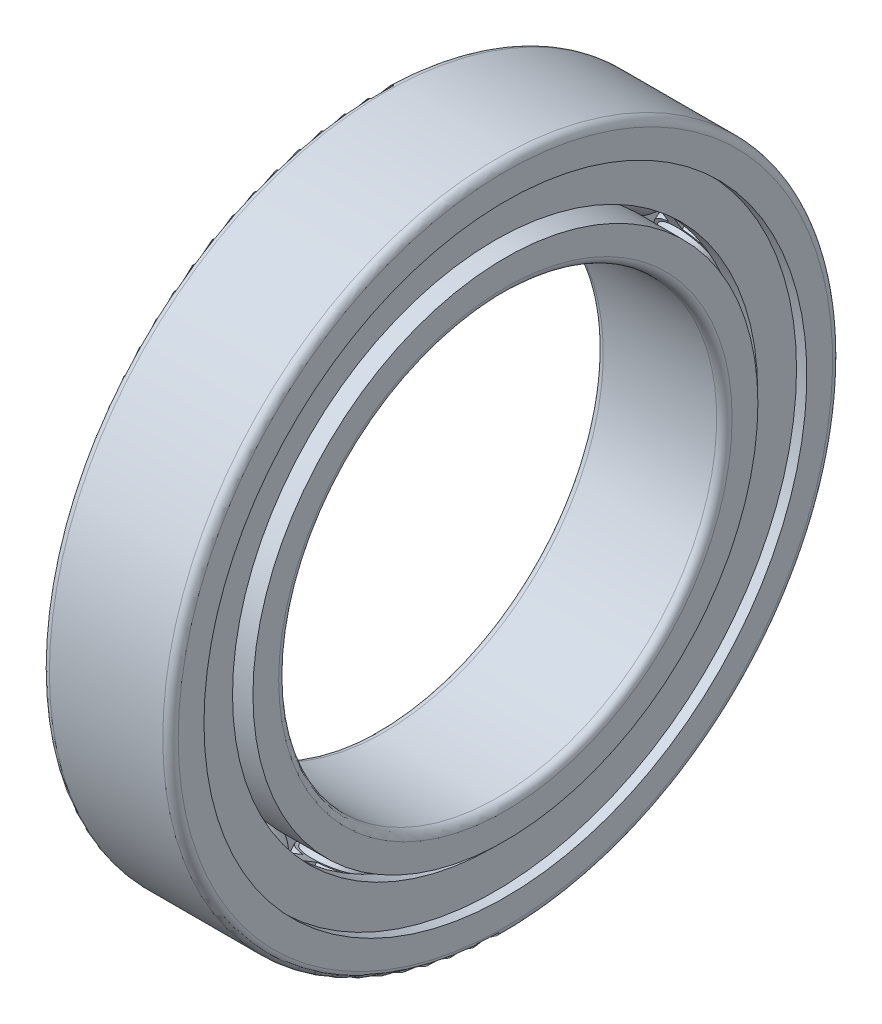
from build123d import *

# Parameters (mm, degrees)
SKETCH_2_W               = 0.52382
SKETCH_2_H               = 0.654775
PATTERN_CIRCULAR_1_COUNT = 16
SKETCH_4_W               = 2.6191
SKETCH_4_H               = 1.30955
SKETCH_5_W               = 2.6191
SKETCH_5_H               = 1.30955
PATTERN_CIRCULAR_2_COUNT = 16
SKETCH_10_W              = 0.535202389
SKETCH_10_H              = 1.957135


with BuildPart() as part:
    # 草图2 → Revolve 572 (revolve)
    with BuildSketch(Plane.XY):
        with Locations((0, 10.75)):
            Rectangle(SKETCH_2_W, SKETCH_2_H)
    revolve(axis=Axis((-12.420610377, 0, 0), (1, 0, 0)))

    # 草图3 → 凸台-旋转1 (revolve)
    with BuildSketch(Plane.XY):
        with BuildLine():
            Line((-1.30955, 10.75), (1.30955, 10.75))
            ThreePointArc((1.30955, 10.75), (0, 9.44045), (-1.30955, 10.75))
        make_face()
    revolve_1 = revolve(axis=Axis((-5.568093779, 10.75, 0), (1, 0, 0)))

    # 阵列(圆周)1: 凸台-旋转1 ×16 about axis
    pattern_circular_1_axis = Axis((-12.420610377, 0, 0), (1, 0, 0))
    for i in range(1, PATTERN_CIRCULAR_1_COUNT):
        add(revolve_1.rotate(pattern_circular_1_axis, i * 360 / PATTERN_CIRCULAR_1_COUNT))

    # 草图4 → 切除-旋转1 (revolve, cut)
    with BuildSketch(Plane.XY):
        with Locations((0, 11.7321625)):
            Rectangle(SKETCH_4_W, SKETCH_4_H)
    revolve(axis=Axis((0, 0, 0), (1, 0, 0)), mode=Mode.SUBTRACT)

    # 草图5 → 切除-旋转2 (revolve, cut)
    with BuildSketch(Plane.XY):
        with Locations((0, 9.7678375)):
            Rectangle(SKETCH_5_W, SKETCH_5_H)
    revolve(axis=Axis((0, 0, 0), (1, 0, 0)), mode=Mode.SUBTRACT)

    # 草图6 → 凸台-旋转2 (revolve)
    with BuildSketch(Plane.XY):
        with BuildLine():
            Line((-1.1905, 10.75), (1.1905, 10.75))
            ThreePointArc((1.1905, 10.75), (0, 9.5595), (-1.1905, 10.75))
        make_face()
    revolve_2 = revolve(axis=Axis((-5.568093779, 10.75, 0), (1, 0, 0)))

    # 阵列(圆周)2: 凸台-旋转2 ×16 about axis
    pattern_circular_2_axis = Axis((-12.420610377, 0, 0), (1, 0, 0))
    for i in range(1, PATTERN_CIRCULAR_2_COUNT):
        add(revolve_2.rotate(pattern_circular_2_axis, i * 360 / PATTERN_CIRCULAR_2_COUNT))

    # 草图7 → 凸台-旋转3 (revolve)
    with BuildSketch(Plane.XY):
        with BuildLine():
            Line((-2.2, 13), (2.2, 13))
            ThreePointArc((2.2, 13), (2.412132034, 12.912132034), (2.5, 12.7))
            Line((2.5, 12.7), (2.5, 11.7))
            Line((2.5, 11.7), (2.1, 11.7))
            Line((2.1, 11.7), (2.1, 12.15))
            Line((2.1, 12.15), (1.564797611, 12.15))
            Line((1.564797611, 12.15), (1.564797611, 11.7))
            Line((1.564797611, 11.7), (0.700771182, 11.7))
            ThreePointArc((0.700771182, 11.7), (0, 11.9305), (-0.700771182, 11.7))
            Line((-0.700771182, 11.7), (-1.564797611, 11.7))
            Line((-1.564797611, 11.7), (-1.564797611, 12.15))
            Line((-1.564797611, 12.15), (-2.1, 12.15))
            Line((-2.1, 12.15), (-2.1, 11.7))
            Line((-2.1, 11.7), (-2.5, 11.7))
            Line((-2.5, 11.7), (-2.5, 12.7))
            ThreePointArc((-2.5, 12.7), (-2.412132034, 12.912132034), (-2.2, 13))
        make_face()
    revolve(axis=Axis((0, 0, 0), (1, 0, 0)))

    # 草图8 → 凸台-旋转4 (revolve)
    with BuildSketch(Plane.XY):
        with BuildLine():
            Line((-2.5, 9.8), (-0.700771182, 9.8))
            ThreePointArc((-0.700771182, 9.8), (0, 9.5695), (0.700771182, 9.8))
            Line((0.700771182, 9.8), (2.5, 9.8))
            Line((2.5, 9.8), (2.5, 8.8))
            ThreePointArc((2.5, 8.8), (2.412132034, 8.587867966), (2.2, 8.5))
            Line((2.2, 8.5), (-2.2, 8.5))
            ThreePointArc((-2.2, 8.5), (-2.412132034, 8.587867966), (-2.5, 8.8))
            Line((-2.5, 8.8), (-2.5, 9.8))
        make_face()
    revolve(axis=Axis((-12.420610377, 0, 0), (1, 0, 0)))

    # 草图10 → 凸台-旋转5 (revolve)
    with BuildSketch(Plane.XY):
        with Locations((1.832398806, 11.1714325)):
            Rectangle(SKETCH_10_W, SKETCH_10_H)
    revolve_5 = revolve(axis=Axis((0, 0, 0), (-1, 0, 0)))

    # 镜向1: 凸台-旋转5 across plane
    add(revolve_5.mirror(Plane(origin=(0, 0, 0), x_dir=(0, 0, 1), z_dir=(1, 0, 0))))


solid = part.part
